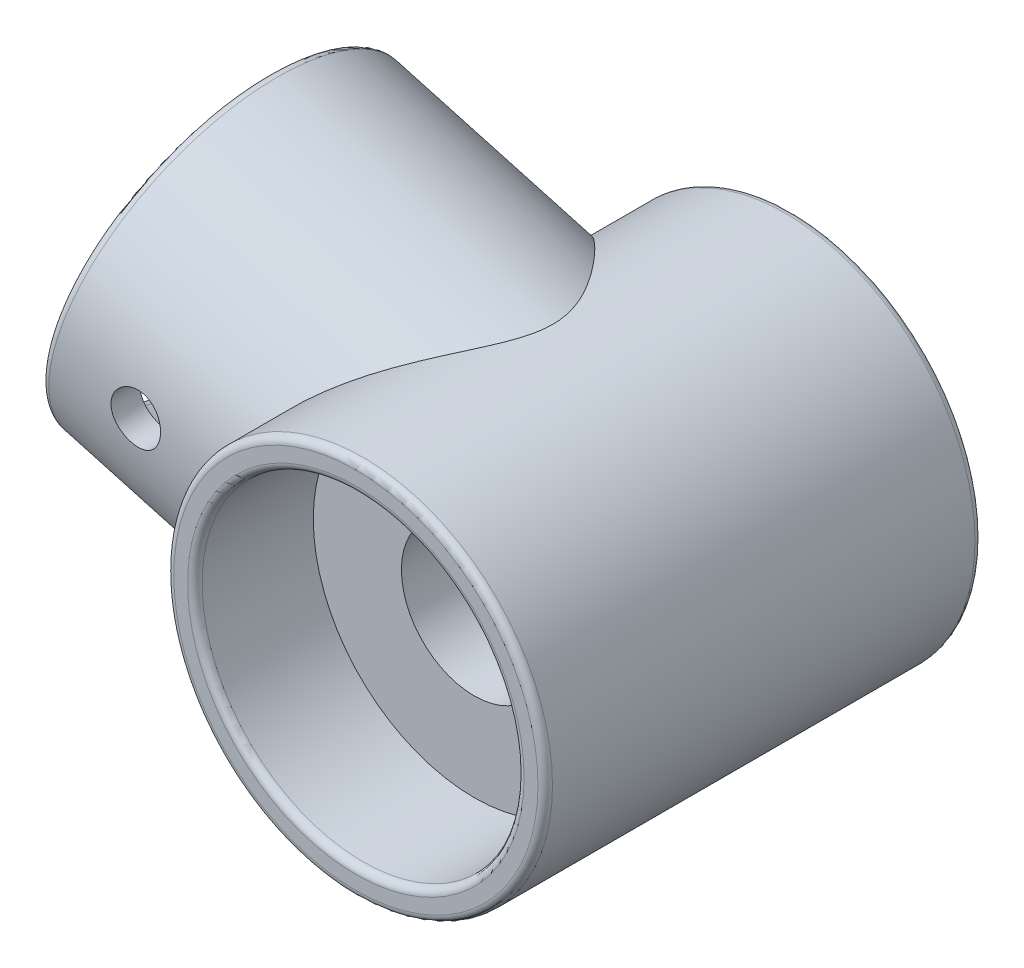
from build123d import *

# Parameters (mm, degrees)
SKETCH2_R                = 13
BOSS_EXTRUDE2_DEPTH      = 15
SKETCH5_R                = 5
CUT_EXTRUDE2_DEPTH       = 36.185224172
BOSS_EXTRUDE4_REACH      = 45.841
BOSS_EXTRUDE4_END_RADIUS = 13
SKETCH1_R                = 12.05
SKETCH1_R_2              = 10.05
SKETCH4_R                = 11.05
CUT_EXTRUDE1_DEPTH       = 8.128
FILLET1_R                = 0.5
CUT_EXTRUDE4_DEPTH       = 36.988676438
CUT_EXTRUDE4_DEPTH_BACK  = 36.988676438
SKETCH11_R               = 1.7
FILLET4_R                = 0.5


with BuildPart() as part:
    # Sketch2 → Boss-Extrude2 (new, symmetric)
    with BuildSketch(Plane.XY):
        Circle(SKETCH2_R)
    extrude(amount=BOSS_EXTRUDE2_DEPTH, both=True)

    # Sketch5 → Cut-Extrude2 (cut, through all)
    with BuildSketch(Plane.XY.offset(15)):
        Circle(SKETCH5_R)
    extrude(amount=-CUT_EXTRUDE2_DEPTH, mode=Mode.SUBTRACT)

    # Boss-Extrude4: up to this cylinder (the profile starts outside it)
    boss_extrude4_end = Plane(origin=(0, 0, 11.709175), z_dir=(0, 0, -1)) * Cylinder(BOSS_EXTRUDE4_END_RADIUS, 118.682, mode=Mode.PRIVATE)
    # Sketch1 → Boss-Extrude4 (add, up to the surface)
    with BuildSketch(Plane(origin=(-25.44650294, 1.795625698, 0), x_dir=(0, 0, -1), z_dir=(0.963583796636428, -0.26740655724893314, 0)), mode=Mode.PRIVATE) as boss_extrude4_sk1:
        with Locations((0, 5.074325918)):
            Circle(SKETCH1_R)
        with Locations((0, 5.074325918)):
            Circle(SKETCH1_R_2, mode=Mode.SUBTRACT)
    boss_extrude4_tool1 = extrude(boss_extrude4_sk1.sketch, amount=BOSS_EXTRUDE4_REACH, mode=Mode.PRIVATE) - boss_extrude4_end
    add(boss_extrude4_tool1.solids().sort_by_distance((-24.089595, 6.685164, 11.709175))[0])

    # Sketch4 → Cut-Extrude1 (cut)
    with BuildSketch(Plane(origin=(0, 0, 15), x_dir=(-1, 0, 0), z_dir=(0, 0, -1))):
        Circle(SKETCH4_R)
    extrude(amount=CUT_EXTRUDE1_DEPTH, mode=Mode.SUBTRACT)

    # Fillet1
    fillet1_edges = [part.edges().sort_by_distance(p)[0] for p in [
        (-24.089594916, 6.685163931, 12.05),
        (-24.089594916, 6.685163931, 10.05),
    ]]
    fillet(fillet1_edges, radius=FILLET1_R)

    # Sketch11 → Cut-Extrude4 (cut, two sides: drawn at the far end of the back side and taken through both)
    with BuildSketch(Plane.XY.offset(-CUT_EXTRUDE4_DEPTH_BACK)):
        with Locations((-18.067196187, 5.013872948)):
            Circle(SKETCH11_R)
    extrude(amount=CUT_EXTRUDE4_DEPTH + CUT_EXTRUDE4_DEPTH_BACK, mode=Mode.SUBTRACT)

    # Fillet4
    fillet4_edges = [part.edges().sort_by_distance(p)[0] for p in [
        (-13, 0, -15),
        (-13, 0, 15),
        (-5, 0, -15),
        (11.05, 0, 15),
    ]]
    fillet(fillet4_edges, radius=FILLET4_R)


solid = part.part
